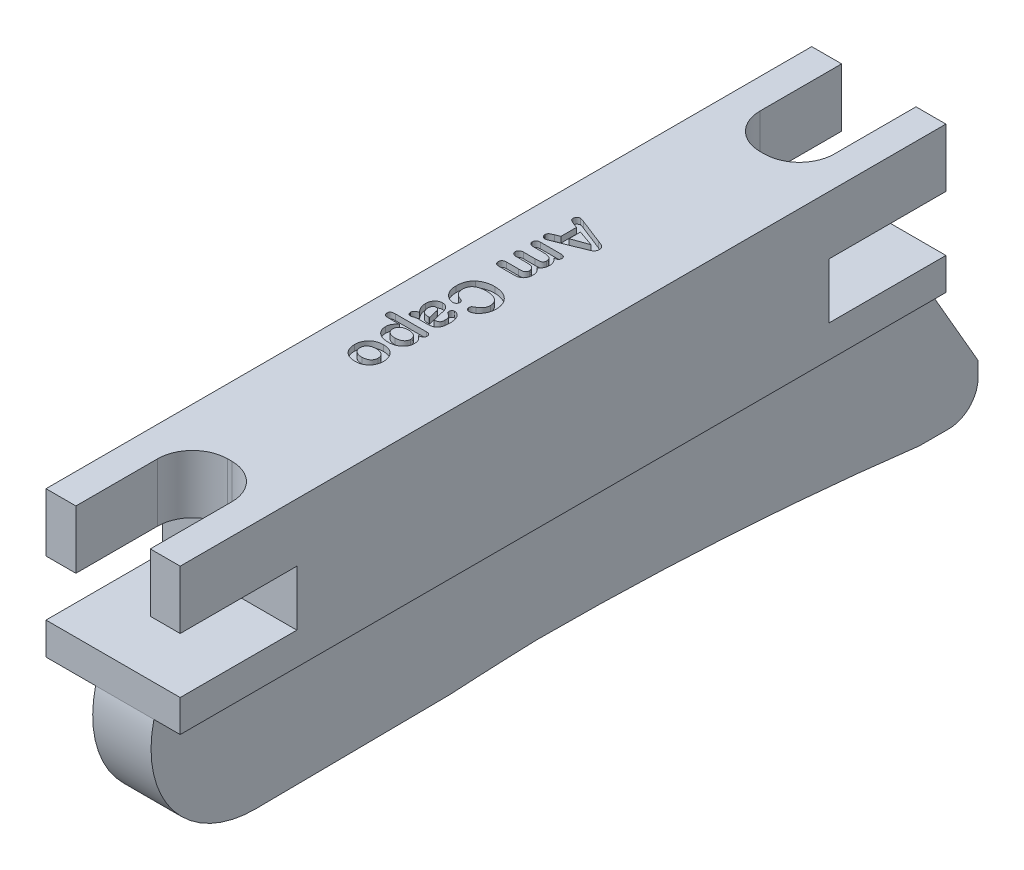
from build123d import *
from OCP.BRepFilletAPI import BRepFilletAPI_MakeChamfer

# Parameters (mm, degrees)
SKETCH2_W            = 11.684
SKETCH2_H            = 66.675
BOSS_EXTRUDE1_DEPTH  = 12.7
SKETCH3_W            = 5.08
SKETCH3_H            = 66.675
SKETCH3_H_2          = 5.08
BOSS_EXTRUDE2_DEPTH  = 12.7
CUT_EXTRUDE1_DEPTH   = 10.16
FILLET2_R            = 3.048
FILLET2_OF_MIRROR1_R = 3.048
CUT_EXTRUDE4_DEPTH   = 74.241572764
CUT_EXTRUDE5_DEPTH   = 0.508
CHAMFER1_SIZE        = 5.08
CHAMFER1_SIZE_2      = 8.798818102
BOSS_EXTRUDE3_DEPTH  = 5.08
FILLET3_R            = 2.54
CUT_EXTRUDE7_DEPTH   = 74.424564272


with BuildPart() as part:
    # Sketch2 → Boss-Extrude1 (new body)
    with BuildSketch(Plane(origin=(0, 0, 0), x_dir=(1, 0, 0), z_dir=(0, 1, 0))):
        with Locations((5.842, 33.3375)):
            Rectangle(SKETCH2_W, SKETCH2_H)
    extrude(amount=BOSS_EXTRUDE1_DEPTH)

    # Sketch3 → Boss-Extrude2 (add)
    with BuildSketch(Plane.XZ):
        with Locations((6.858, -33.3375)):
            Rectangle(SKETCH3_W, SKETCH3_H)
        with Locations((6.858, -69.215)):
            Rectangle(SKETCH3_W, SKETCH3_H_2)
        with Locations((6.858, 2.54)):
            Rectangle(SKETCH3_W, SKETCH3_H_2)
    extrude(amount=BOSS_EXTRUDE2_DEPTH)

    # Sketch4 → Cut-Extrude1 (cut)
    with BuildSketch(Plane.XY):
        Polygon((0, 7.62), (2.6035, 7.62), (2.6035, 12.7), (9.0805, 12.7), (9.0805, 7.62), (11.684, 7.62), (11.684, 2.794), (0, 2.794), align=None)
    cut_extrude1 = extrude(amount=-CUT_EXTRUDE1_DEPTH, mode=Mode.SUBTRACT)

    # Fillet2
    fillet2_edges = [part.edges().sort_by_distance(p)[0] for p in [
        (2.6035, 10.16, -10.16),
        (9.0805, 10.16, -10.16),
    ]]
    fillet(fillet2_edges, radius=FILLET2_R)

    # Mirror1: Cut-Extrude1 across plane
    add(cut_extrude1.mirror(Plane.XY.offset(-33.3375)), mode=Mode.SUBTRACT)

    # Fillet2 of Mirror1
    fillet2_of_mirror1_edges = [part.edges().sort_by_distance(p)[0] for p in [
        (2.6035, 10.16, -56.515),
        (9.0805, 10.16, -56.515),
    ]]
    fillet(fillet2_of_mirror1_edges, radius=FILLET2_OF_MIRROR1_R)

    # Sketch5 → Cut-Extrude4 (cut, through all)
    with BuildSketch(Plane.ZY.offset(-4.318)):
        with BuildLine():
            Line((-66.675, -12.7), (0, -12.7))
            ThreePointArc((0, -12.7), (-33.3375, -10.668), (-66.675, -12.7))
        make_face()
    extrude(amount=-CUT_EXTRUDE4_DEPTH, mode=Mode.SUBTRACT)

    # Sketch6 → Cut-Extrude5 (cut)
    # profile 1 of 6: a face of its own
    with BuildSketch(Plane(origin=(0, 12.7, 0), x_dir=(1, 0, 0), z_dir=(0, 1, 0))):
        with BuildLine():
            add(Edge.make_bspline(
                [(3.827132812, 23.05625), (3.781504243, 23.057239782), (3.691766633, 23.059186384), (3.560106764, 23.076349618), (3.433568163, 23.102382409), (3.3132634, 23.140919959), (3.199714977, 23.189371492), (3.093590228, 23.247263483), (2.996995776, 23.316645808), (2.907405092, 23.393504798), (2.82810537, 23.480916035), (2.758215777, 23.576341742), (2.697481033, 23.67942341), (2.647796863, 23.79073917), (2.607664085, 23.90939206), (2.580295602, 24.035754597), (2.562500875, 24.168860779), (2.560679944, 24.259998959), (2.55975, 24.306542969)],
                knots=[0, 0, 0, 0, 1.091259345, 2.146177441, 3.171619965, 4.178561867, 5.162889412, 6.121888061, 7.064316506, 8.003395826, 8.941144824, 9.881109978, 10.829245542, 11.797988921, 12.792769476, 13.820528274, 14.886949991, 16, 16, 16, 16], degree=3))
            add(Edge.make_bspline(
                [(2.55975, 24.306542969), (2.560583935, 24.352872717), (2.562213198, 24.443387383), (2.58125599, 24.575214147), (2.608108843, 24.700438636), (2.649346344, 24.817787788), (2.699716679, 24.928359847), (2.760751975, 25.031222651), (2.831717594, 25.126164008), (2.911722278, 25.21316981), (3.00086545, 25.291331758), (3.098124272, 25.359666663), (3.202884072, 25.418432205), (3.31534315, 25.466047871), (3.434856104, 25.503648602), (3.560632201, 25.531063231), (3.692748016, 25.546787096), (3.782657855, 25.548915033), (3.8285, 25.55)],
                knots=[0, 0, 0, 0, 1.11120768, 2.170972137, 3.191401705, 4.180825011, 5.150009136, 6.104010418, 7.045892499, 7.99039143, 8.936124897, 9.886087878, 10.83864551, 11.813968496, 12.812107101, 13.842035622, 14.899723118, 16, 16, 16, 16], degree=3))
            add(Edge.make_bspline(
                [(3.8285, 25.55), (3.874809089, 25.549001174), (3.965676938, 25.547041275), (4.099015034, 25.530084201), (4.2263778, 25.503243946), (4.346963148, 25.464467565), (4.460952104, 25.417147745), (4.566270872, 25.358649191), (4.663834875, 25.291631968), (4.751139088, 25.213758948), (4.830515954, 25.128108344), (4.899858962, 25.033060995), (4.959371339, 24.929332246), (5.00928736, 24.817585394), (5.048992538, 24.698813579), (5.076764742, 24.573259256), (5.094424274, 24.441943655), (5.096297721, 24.352173443), (5.09725, 24.306542969)],
                knots=[0, 0, 0, 0, 1.109551132, 2.177164951, 3.216234439, 4.224948079, 5.208872635, 6.169558664, 7.107368683, 8.039883902, 8.967540442, 9.901525901, 10.853306172, 11.828735993, 12.830446654, 13.849355003, 14.906820559, 16, 16, 16, 16], degree=3))
            add(Edge.make_bspline(
                [(5.09725, 24.306542969), (5.096291639, 24.260231721), (5.094410549, 24.169331074), (5.076917192, 24.036339538), (5.048468826, 23.909869753), (5.007946665, 23.790662509), (4.957097339, 23.678841388), (4.897240194, 23.574291196), (4.826110051, 23.478821194), (4.746168688, 23.391972151), (4.657435921, 23.313994246), (4.559897541, 23.24649139), (4.454800415, 23.187778597), (4.341628831, 23.140271799), (4.221760095, 23.102426832), (4.09553282, 23.07632151), (3.963411811, 23.059133908), (3.873217516, 23.057225235), (3.827132812, 23.05625)],
                knots=[0, 0, 0, 0, 1.106525973, 2.171911401, 3.199869828, 4.200585073, 5.175594314, 6.132220136, 7.07450443, 8.015024027, 8.949086891, 9.891921975, 10.845223852, 11.821449384, 12.820577379, 13.845023435, 14.89891642, 16, 16, 16, 16], degree=3))
        make_face()
        with BuildLine():
            add(Edge.make_bspline(
                [(3.827132812, 23.66875), (3.857455733, 23.669253201), (3.916395722, 23.670231295), (4.002105478, 23.678409297), (4.082608202, 23.692450053), (4.158472577, 23.709951911), (4.228550989, 23.735360399), (4.294162007, 23.764114424), (4.353638932, 23.800360953), (4.408661427, 23.840239417), (4.457004895, 23.885690101), (4.500062077, 23.934215647), (4.53573269, 23.987506418), (4.565163245, 24.044119631), (4.587917424, 24.1045044), (4.604436851, 24.168398622), (4.613934509, 24.236304224), (4.615302266, 24.282815948), (4.616, 24.306542969)],
                knots=[0, 0, 0, 0, 1.270595497, 2.469712118, 3.603154456, 4.694003366, 5.726889095, 6.722647569, 7.690497426, 8.639701942, 9.565367191, 10.465461596, 11.352699765, 12.245317202, 13.133839103, 14.050993671, 15.00575362, 16, 16, 16, 16], degree=3))
            add(Edge.make_bspline(
                [(4.616, 24.306542969), (4.615131391, 24.337177096), (4.613430307, 24.397171041), (4.594752496, 24.483834068), (4.566252312, 24.565248485), (4.524731238, 24.640022596), (4.472508621, 24.708012444), (4.409528164, 24.768898173), (4.333747364, 24.818843179), (4.248829356, 24.862195369), (4.154340788, 24.895930767), (4.051950579, 24.920575867), (3.941927636, 24.9349118), (3.866140093, 24.93662053), (3.827132812, 24.9375)],
                knots=[0, 0, 0, 0, 0.96705303, 1.893878874, 2.789407141, 3.685746366, 4.584860462, 5.491819201, 6.440915387, 7.442891259, 8.500283372, 9.604563114, 10.767086573, 12, 12, 12, 12], degree=3))
            add(Edge.make_bspline(
                [(3.827132812, 24.9375), (3.788574367, 24.936647134), (3.713681338, 24.93499059), (3.604936267, 24.920278808), (3.503513993, 24.896838601), (3.410166339, 24.86326704), (3.325751364, 24.821351044), (3.251618858, 24.770008106), (3.187215249, 24.711152453), (3.134205654, 24.643325927), (3.092044533, 24.568532628), (3.062742528, 24.486681688), (3.044372748, 24.398729762), (3.042145557, 24.3378543), (3.041, 24.306542969)],
                knots=[0, 0, 0, 0, 1.221452891, 2.372458373, 3.470695752, 4.514597835, 5.509283355, 6.448751658, 7.363470559, 8.263476682, 9.165479573, 10.07241203, 11.008543944, 12, 12, 12, 12], degree=3))
            add(Edge.make_bspline(
                [(3.041, 24.306542969), (3.041697421, 24.282815734), (3.043064564, 24.236303589), (3.052566629, 24.168401006), (3.069070247, 24.104495953), (3.091881334, 24.044150176), (3.121159217, 23.987277574), (3.157714363, 23.934434966), (3.200624958, 23.885648305), (3.249054063, 23.84028096), (3.304128987, 23.800118222), (3.363958335, 23.764508706), (3.429258225, 23.735142396), (3.499031772, 23.710106424), (3.574375238, 23.692417921), (3.65421047, 23.678415582), (3.739007767, 23.670250467), (3.797265423, 23.669258539), (3.827132812, 23.66875)],
                knots=[0, 0, 0, 0, 0.996887209, 1.954183106, 2.873773739, 3.764655653, 4.659643981, 5.554632309, 6.457117465, 7.385241384, 8.336967093, 9.315618294, 10.305307001, 11.340936189, 12.425381747, 13.552398284, 14.745169664, 16, 16, 16, 16], degree=3))
        make_face(mode=Mode.SUBTRACT)
    # profile 2 of 6: a face of its own
    with BuildSketch(Plane(origin=(0, 12.7, 0), x_dir=(1, 0, 0), z_dir=(0, 1, 0))):
        with BuildLine():
            Line((4.737679687, 27.78125), (4.659066406, 27.78125))
            add(Edge.make_bspline(
                [(4.659066406, 27.78125), (4.695000552, 27.752550703), (4.764199162, 27.697284288), (4.854494173, 27.60605423), (4.931665741, 27.514805067), (4.992560726, 27.419706103), (5.040370623, 27.321287419), (5.073023457, 27.216687675), (5.093395186, 27.105968682), (5.095947979, 27.029842733), (5.09725, 26.991015625)],
                knots=[0, 0, 0, 0, 1.173336753, 2.259501931, 3.271928111, 4.219334659, 5.135402612, 6.057309498, 7.009154491, 8, 8, 8, 8], degree=3))
            add(Edge.make_bspline(
                [(5.09725, 26.991015625), (5.095318145, 26.944181481), (5.091496345, 26.851529205), (5.063697477, 26.715157154), (5.015669131, 26.585330067), (4.961700737, 26.482364636), (4.909357935, 26.404749843), (4.865517285, 26.349185442), (4.817305152, 26.297085555), (4.765145185, 26.247607123), (4.708705307, 26.201142122), (4.647263964, 26.158848161), (4.582094318, 26.118950685), (4.512764788, 26.082271152), (4.439601711, 26.049252595), (4.362882107, 26.021544126), (4.283068166, 25.997362938), (4.199995558, 25.97760873), (4.113428723, 25.96269813), (4.023765662, 25.95188675), (3.930700731, 25.944691302), (3.867478584, 25.944067265), (3.835335937, 25.94375)],
                knots=[0, 0, 0, 0, 1.528238337, 3.023323336, 4.519758183, 6.033521898, 6.805016636, 7.572809931, 8.341287358, 9.11991911, 9.91795254, 10.724672492, 11.552509732, 12.410888457, 13.283107479, 14.170167426, 15.071333123, 16.003990564, 16.955292722, 17.936845165, 18.951075513, 20, 20, 20, 20], degree=3))
            add(Edge.make_bspline(
                [(3.835335937, 25.94375), (3.788112454, 25.94447395), (3.695440928, 25.945894633), (3.559624706, 25.962843358), (3.429231467, 25.986418247), (3.305817271, 26.022140345), (3.19047045, 26.066820714), (3.083112927, 26.117329286), (2.986443832, 26.177428783), (2.898785018, 26.243805981), (2.821318213, 26.31773047), (2.754045829, 26.398762231), (2.694652191, 26.484723624), (2.646072681, 26.577553472), (2.607892071, 26.675527458), (2.579681129, 26.777364626), (2.562805775, 26.883128875), (2.560777911, 26.954724338), (2.55975, 26.991015625)],
                knots=[0, 0, 0, 0, 1.225552878, 2.405029155, 3.549292819, 4.663622026, 5.735037092, 6.759253393, 7.739611413, 8.685210345, 9.610125572, 10.513205615, 11.415878476, 12.318434966, 13.227157865, 14.141584524, 15.057980963, 16, 16, 16, 16], degree=3))
            add(Edge.make_bspline(
                [(2.55975, 26.991015625), (2.561027194, 27.033478967), (2.563493631, 27.115481505), (2.583342198, 27.233234623), (2.616633163, 27.340722644), (2.665151917, 27.4383474), (2.72702349, 27.528838244), (2.799740551, 27.616536661), (2.885043388, 27.701729304), (2.948709382, 27.754201905), (2.981527344, 27.78125)],
                knots=[0, 0, 0, 0, 1.092260036, 2.10930392, 3.062543473, 3.97778116, 4.903181409, 5.877718058, 6.906025603, 8, 8, 8, 8], degree=3))
            Line((2.981527344, 27.78125), (2.019710937, 27.78125))
            add(Edge.make_bspline(
                [(2.019710937, 27.78125), (1.986609986, 27.782035512), (1.924607502, 27.783506882), (1.837765834, 27.797647968), (1.763775225, 27.821407687), (1.70291334, 27.856343019), (1.654649485, 27.900706436), (1.621091553, 27.956200257), (1.600675253, 28.021171431), (1.598432098, 28.067742926), (1.59725, 28.092285156)],
                knots=[0, 0, 0, 0, 1.33001148, 2.49128837, 3.525600985, 4.437006695, 5.29254635, 6.131641311, 7.015413011, 8, 8, 8, 8], degree=3))
            add(Edge.make_bspline(
                [(1.59725, 28.092285156), (1.597342558, 28.106894633), (1.59751975, 28.134862779), (1.603538525, 28.174814708), (1.611247655, 28.211157762), (1.622837525, 28.243662702), (1.638124627, 28.272168954), (1.656525111, 28.297114753), (1.678928438, 28.317938923), (1.713982952, 28.341366906), (1.767233148, 28.362843466), (1.840227759, 28.380655829), (1.925225938, 28.39256944), (1.985942433, 28.393339212), (2.01834375, 28.39375)],
                knots=[0, 0, 0, 0, 0.874698912, 1.674509344, 2.416841684, 3.099593518, 3.73521067, 4.349933258, 4.949129653, 5.55912881, 6.868543326, 8.362792448, 10.059006585, 12, 12, 12, 12], degree=3))
            Line((2.01834375, 28.39375), (4.743148437, 28.39375))
            add(Edge.make_bspline(
                [(4.743148437, 28.39375), (4.771482621, 28.393019629), (4.824738234, 28.391646858), (4.899007802, 28.376717737), (4.962295047, 28.351796692), (5.013262862, 28.31530574), (5.053546536, 28.270602222), (5.081580837, 28.217468379), (5.099511549, 28.157224394), (5.101170959, 28.114523288), (5.102035156, 28.092285156)],
                knots=[0, 0, 0, 0, 1.274934873, 2.396308233, 3.395220789, 4.315276865, 5.195051252, 6.081507868, 7.00087648, 8, 8, 8, 8], degree=3))
            add(Edge.make_bspline(
                [(5.102035156, 28.092285156), (5.10083011, 28.070300705), (5.098505765, 28.027896126), (5.081077302, 27.966882547), (5.050250966, 27.913102118), (5.008591614, 27.865905328), (4.956187867, 27.826817849), (4.891796092, 27.800472358), (4.818041221, 27.783918124), (4.765349583, 27.782168682), (4.737679687, 27.78125)],
                knots=[0, 0, 0, 0, 0.97573183, 1.882034617, 2.788280906, 3.705980645, 4.661295753, 5.663177366, 6.77286718, 8, 8, 8, 8], degree=3))
        make_face()
        with BuildLine():
            add(Edge.make_bspline(
                [(3.831917969, 26.55625), (3.87138869, 26.557081876), (3.947647106, 26.558689081), (4.057486624, 26.573422082), (4.158896973, 26.596261872), (4.251516599, 26.628852236), (4.3343456, 26.670731622), (4.407866631, 26.719287105), (4.470871922, 26.775867614), (4.52302975, 26.839644138), (4.563935209, 26.909011938), (4.594964716, 26.981830695), (4.612155337, 27.059042045), (4.614708947, 27.111477817), (4.616, 27.137988281)],
                knots=[0, 0, 0, 0, 1.30121544, 2.513980591, 3.647898742, 4.724690636, 5.74306597, 6.701881505, 7.622470714, 8.525092457, 9.407975465, 10.270504535, 11.125602123, 12, 12, 12, 12], degree=3))
            add(Edge.make_bspline(
                [(4.616, 27.137988281), (4.615244868, 27.15920749), (4.613760466, 27.200919142), (4.60496622, 27.262215851), (4.5892902, 27.320827424), (4.566067913, 27.376347915), (4.538350475, 27.43023351), (4.503036667, 27.480877559), (4.46154614, 27.528911723), (4.414666092, 27.57478225), (4.36125478, 27.61661215), (4.301628251, 27.652918201), (4.235600715, 27.682994204), (4.164108028, 27.708410115), (4.086308657, 27.726947811), (4.003072207, 27.741771199), (3.913645025, 27.749621316), (3.851983278, 27.750645548), (3.820296875, 27.751171875)],
                knots=[0, 0, 0, 0, 0.902184776, 1.773469393, 2.626468711, 3.473728321, 4.327332466, 5.197916759, 6.091006804, 7.022665092, 7.981866007, 8.968696632, 9.982866901, 11.061295835, 12.189021605, 13.378660771, 14.65296049, 16, 16, 16, 16], degree=3))
            add(Edge.make_bspline(
                [(3.820296875, 27.751171875), (3.790428185, 27.750669459), (3.732167992, 27.749689473), (3.647388672, 27.741439736), (3.567653448, 27.727762885), (3.492822477, 27.709122647), (3.423616716, 27.683222482), (3.358692172, 27.653726147), (3.299865752, 27.616846593), (3.245809919, 27.576200454), (3.197778314, 27.530916569), (3.156264281, 27.482284807), (3.120067915, 27.431632172), (3.091345992, 27.377726899), (3.06852719, 27.321667251), (3.052819706, 27.26263252), (3.043066997, 27.201203612), (3.041694096, 27.159215954), (3.041, 27.137988281)],
                knots=[0, 0, 0, 0, 1.288880695, 2.514018438, 3.671617053, 4.778346991, 5.836152296, 6.856826722, 7.850275696, 8.825846236, 9.771976063, 10.692511868, 11.581949935, 12.453151322, 13.322407875, 14.188376105, 15.084098501, 16, 16, 16, 16], degree=3))
            add(Edge.make_bspline(
                [(3.041, 27.137988281), (3.041978427, 27.112370201), (3.043922823, 27.061460203), (3.061809283, 26.986981821), (3.090478479, 26.915611074), (3.129051641, 26.846995279), (3.180383482, 26.783843566), (3.24248696, 26.726679997), (3.315991669, 26.676495054), (3.400303515, 26.63365715), (3.494789949, 26.598913681), (3.598862057, 26.573717448), (3.712298644, 26.558589067), (3.791081599, 26.557048525), (3.831917969, 26.55625)],
                knots=[0, 0, 0, 0, 0.839678771, 1.668666964, 2.497688886, 3.358447987, 4.241368201, 5.15690626, 6.11937314, 7.152810166, 8.253003143, 9.415598002, 10.660400639, 12, 12, 12, 12], degree=3))
        make_face(mode=Mode.SUBTRACT)
    # profile 3 of 6: a face of its own
    with BuildSketch(Plane(origin=(0, 12.7, 0), x_dir=(1, 0, 0), z_dir=(0, 1, 0))):
        with BuildLine():
            add(Edge.make_bspline(
                [(2.936410156, 29.577050781), (2.906610435, 29.614104585), (2.848917661, 29.68584139), (2.771597832, 29.79539679), (2.707542746, 29.903913613), (2.652339906, 30.010803813), (2.610731069, 30.121307147), (2.581478374, 30.236850276), (2.563206118, 30.358730897), (2.560919355, 30.442187195), (2.55975, 30.484863281)],
                knots=[0, 0, 0, 0, 1.134918657, 2.197222132, 3.197207938, 4.141015931, 5.065376899, 6.008620489, 6.981691201, 8, 8, 8, 8], degree=3))
            add(Edge.make_bspline(
                [(2.55975, 30.484863281), (2.560996407, 30.523657374), (2.563421244, 30.599129759), (2.580357854, 30.708772972), (2.610086404, 30.810543237), (2.650212585, 30.905017333), (2.701735244, 30.98987103), (2.76039669, 31.066407369), (2.828976897, 31.130939498), (2.904409527, 31.185091441), (2.985585563, 31.228636129), (3.071796963, 31.258242372), (3.160886634, 31.27789136), (3.221591912, 31.280123445), (3.252230469, 31.28125)],
                knots=[0, 0, 0, 0, 1.18420515, 2.303824621, 3.375910304, 4.413522982, 5.427550473, 6.398827283, 7.348465677, 8.290532625, 9.227164998, 10.148982359, 11.065773, 12, 12, 12, 12], degree=3))
            add(Edge.make_bspline(
                [(3.252230469, 31.28125), (3.27274699, 31.280589386), (3.313207044, 31.279286608), (3.373129358, 31.273006949), (3.430271275, 31.259337044), (3.485586157, 31.242887309), (3.537626164, 31.219333632), (3.588836343, 31.193453143), (3.63619272, 31.160007643), (3.681792052, 31.123147634), (3.723830419, 31.081434991), (3.762890254, 31.036175238), (3.798816138, 30.987557689), (3.830205838, 30.9344648), (3.858095687, 30.877703665), (3.882837838, 30.817509486), (3.903446471, 30.753462037), (3.914016751, 30.709160635), (3.919417969, 30.686523438)],
                knots=[0, 0, 0, 0, 1.01250585, 1.996734246, 2.964656916, 3.906654277, 4.83786248, 5.777980677, 6.731903795, 7.690318475, 8.667850486, 9.647963445, 10.637056683, 11.645124027, 12.68556377, 13.754152863, 14.852413628, 16, 16, 16, 16], degree=3))
            add(Edge.make_bspline(
                [(3.919417969, 30.686523438), (3.92077232, 30.680596027), (3.923899517, 30.666909631), (3.929555334, 30.643761164), (3.935441145, 30.614939793), (3.943034914, 30.580776396), (3.952087447, 30.541214), (3.961466996, 30.49577804), (3.972506932, 30.445034257), (3.987556192, 30.371064276), (4.007436317, 30.279191326), (4.03151831, 30.173773082), (4.05411983, 30.076713566), (4.082472096, 29.955674956), (4.124106753, 29.803956395), (4.159846292, 29.682264981), (4.1785, 29.61875)],
                knots=[0, 0, 0, 0, 0.232329944, 0.53645003, 0.910442946, 1.356200488, 1.873732251, 2.461176041, 3.128890498, 3.858040884, 5.345500004, 6.720561501, 7.989893742, 9.153532225, 11.470459955, 14, 14, 14, 14], degree=3))
            add(Edge.make_bspline(
                [(4.1785, 29.61875), (4.217347759, 29.621218301), (4.290124117, 29.625842351), (4.390496629, 29.646338337), (4.474905317, 29.67503337), (4.533887867, 29.708358064), (4.572329546, 29.741959461), (4.595466388, 29.773870558), (4.616064383, 29.810660984), (4.632325189, 29.853536657), (4.644516056, 29.902198306), (4.65305558, 29.956656398), (4.658555225, 30.016947002), (4.65934083, 30.058971558), (4.65975, 30.080859375)],
                knots=[0, 0, 0, 0, 1.801419441, 3.374731284, 4.730208451, 5.917792687, 6.485835615, 7.081173764, 7.733231515, 8.434998629, 9.197926469, 10.053449113, 10.986170169, 12, 12, 12, 12], degree=3))
            add(Edge.make_bspline(
                [(4.65975, 30.080859375), (4.65906538, 30.118038181), (4.65778414, 30.187616855), (4.645898996, 30.284901038), (4.62548901, 30.367723904), (4.59535018, 30.437410328), (4.5559461, 30.496441537), (4.509722754, 30.550047992), (4.455479595, 30.599963398), (4.393821792, 30.641545038), (4.334997992, 30.679255746), (4.285309811, 30.712555196), (4.246736487, 30.739555298), (4.216589883, 30.76079206), (4.19465541, 30.786580021), (4.183214868, 30.821373074), (4.174667163, 30.864736608), (4.174053921, 30.897002889), (4.173714844, 30.91484375)],
                knots=[0, 0, 0, 0, 1.73013111, 3.237872341, 4.552513207, 5.687673037, 6.752672015, 7.843349881, 8.977121257, 10.171964914, 11.298768358, 12.231350577, 12.955203784, 13.491991011, 13.94425741, 14.501711647, 15.171557632, 16, 16, 16, 16], degree=3))
            add(Edge.make_bspline(
                [(4.173714844, 30.91484375), (4.174408325, 30.931796218), (4.175770304, 30.96509042), (4.189337993, 31.012865818), (4.210961292, 31.056827327), (4.240306111, 31.09623417), (4.276098858, 31.130158354), (4.318620646, 31.154211836), (4.365705178, 31.169408984), (4.398726284, 31.171037535), (4.415707031, 31.171875)],
                knots=[0, 0, 0, 0, 1.032443871, 2.027692603, 3.004109543, 4.008160394, 5.011922295, 5.989922401, 6.966339342, 8, 8, 8, 8], degree=3))
            add(Edge.make_bspline(
                [(4.415707031, 31.171875), (4.443193342, 31.170355495), (4.498787372, 31.167282131), (4.581007452, 31.144092122), (4.661980003, 31.107370421), (4.740715465, 31.055443426), (4.816608738, 30.989017467), (4.884934316, 30.905091043), (4.945976584, 30.805132643), (4.999654289, 30.689468907), (5.044260174, 30.558157523), (5.074889204, 30.411050512), (5.094311505, 30.24931731), (5.096243867, 30.136291241), (5.09725, 30.077441406)],
                knots=[0, 0, 0, 0, 0.693420704, 1.402518181, 2.141636884, 2.931686233, 3.775620559, 4.678911608, 5.653034846, 6.726531372, 7.892968482, 9.146908502, 10.514466916, 12, 12, 12, 12], degree=3))
            add(Edge.make_bspline(
                [(5.09725, 30.077441406), (5.097069135, 30.044166082), (5.096717112, 29.979401255), (5.091633548, 29.884795479), (5.084316939, 29.79563486), (5.07426089, 29.711871669), (5.060745784, 29.633784955), (5.043448602, 29.561083054), (5.023991877, 29.493631341), (5.00134729, 29.431413823), (4.975405863, 29.374425356), (4.945669912, 29.321819507), (4.912610863, 29.273673586), (4.875648491, 29.229821128), (4.835573037, 29.190210037), (4.791319938, 29.15495165), (4.743430512, 29.124520818), (4.692405647, 29.097310524), (4.637163178, 29.075092849), (4.578067428, 29.05519515), (4.514936495, 29.037940721), (4.447125429, 29.025574434), (4.375419099, 29.014115211), (4.299141978, 29.007202839), (4.21867721, 29.001966536), (4.163698596, 29.001635191), (4.135433594, 29.001464844)],
                knots=[0, 0, 0, 0, 1.416304911, 2.756599448, 4.031746177, 5.224033762, 6.346700176, 7.403089038, 8.403721962, 9.333538543, 10.218988155, 11.065987521, 11.902761167, 12.701332918, 13.503841873, 14.297627645, 15.104812584, 15.916182868, 16.75559468, 17.635929123, 18.570036295, 19.538318192, 20.568554759, 21.660160367, 22.797067306, 24, 24, 24, 24], degree=3))
            add(Edge.make_bspline(
                [(4.135433594, 29.001464844), (4.100342562, 29.001493383), (4.032894866, 29.001548239), (3.935822168, 29.001171955), (3.846959124, 29.002424099), (3.736663937, 29.001746483), (3.596309126, 29.004591929), (3.482830226, 29.005678404), (3.423128906, 29.00625)],
                knots=[0, 0, 0, 0, 0.886722124, 1.704349017, 2.452902826, 3.132339258, 4.49132191, 6, 6, 6, 6], degree=3))
            add(Edge.make_bspline(
                [(3.423128906, 29.00625), (3.393472758, 29.005630026), (3.333506219, 29.004376401), (3.242786906, 28.992762293), (3.150222553, 28.974409767), (3.059570787, 28.948636827), (2.977027412, 28.922303109), (2.906969508, 28.905224292), (2.85463615, 28.891700508), (2.824571553, 28.889530291), (2.812679687, 28.888671875)],
                knots=[0, 0, 0, 0, 1.140195027, 2.30554383, 3.512149168, 4.766631608, 5.928448693, 6.842497462, 7.542157007, 8, 8, 8, 8], degree=3))
            add(Edge.make_bspline(
                [(2.812679687, 28.888671875), (2.79703654, 28.889707423), (2.765268806, 28.891810391), (2.719215714, 28.910033936), (2.676319442, 28.939893488), (2.636818956, 28.979003881), (2.603242697, 29.025187721), (2.578259179, 29.075765033), (2.562174239, 29.129464193), (2.560565402, 29.166553641), (2.55975, 29.185351562)],
                knots=[0, 0, 0, 0, 0.875490473, 1.777925396, 2.735475759, 3.793375106, 4.882946873, 5.923706805, 6.947679186, 8, 8, 8, 8], degree=3))
            add(Edge.make_bspline(
                [(2.55975, 29.185351562), (2.5610186, 29.201688137), (2.56361083, 29.23506993), (2.583005713, 29.284222997), (2.613714169, 29.332524807), (2.657428044, 29.379666497), (2.711931575, 29.427349719), (2.77735243, 29.476111615), (2.852339461, 29.527809293), (2.907467989, 29.560098913), (2.936410156, 29.577050781)],
                knots=[0, 0, 0, 0, 0.69255206, 1.41514551, 2.215225972, 3.112878123, 4.134275469, 5.28776696, 6.576092927, 8, 8, 8, 8], degree=3))
        make_face()
        with BuildLine():
            add(Edge.make_bspline(
                [(3.78475, 29.61875), (3.77647886, 29.644185812), (3.758309008, 29.700062622), (3.735733452, 29.792905376), (3.709819417, 29.90072063), (3.685424341, 30.018477169), (3.663536346, 30.134366232), (3.641820786, 30.235338825), (3.625092258, 30.316412871), (3.610442314, 30.380451027), (3.594960157, 30.434438027), (3.57360037, 30.483429532), (3.546387577, 30.53119724), (3.514582444, 30.576978274), (3.476470925, 30.618568806), (3.428267253, 30.647469839), (3.373689107, 30.666370683), (3.334656632, 30.667938077), (3.3144375, 30.66875)],
                knots=[0, 0, 0, 0, 1.043977844, 2.293386608, 3.728469663, 5.37392038, 6.987897688, 8.333217955, 9.406358624, 10.219929069, 10.898257848, 11.595688491, 12.30085073, 13.041383056, 13.771256586, 14.482343253, 15.213841736, 16, 16, 16, 16], degree=3))
            add(Edge.make_bspline(
                [(3.3144375, 30.66875), (3.29310231, 30.667413459), (3.251065618, 30.664780075), (3.190412259, 30.64433492), (3.136268839, 30.60839868), (3.087200902, 30.5616565), (3.046779963, 30.503346995), (3.018032866, 30.43540134), (2.999715537, 30.359585439), (2.998090876, 30.306100287), (2.99725, 30.278417969)],
                knots=[0, 0, 0, 0, 0.912396036, 1.79769247, 2.701443981, 3.674205933, 4.683500188, 5.714572396, 6.817130875, 8, 8, 8, 8], degree=3))
            add(Edge.make_bspline(
                [(2.99725, 30.278417969), (2.998113213, 30.247820357), (2.999810872, 30.187644764), (3.014927794, 30.099467286), (3.037912728, 30.014713093), (3.070528676, 29.934985922), (3.1102139, 29.861878101), (3.157078221, 29.798827563), (3.208264057, 29.744560296), (3.247844128, 29.717028088), (3.267269531, 29.703515625)],
                knots=[0, 0, 0, 0, 1.110580976, 2.184153044, 3.240356413, 4.294709725, 5.306018023, 6.252887922, 7.142539285, 8, 8, 8, 8], degree=3))
            add(Edge.make_bspline(
                [(3.267269531, 29.703515625), (3.278965833, 29.696601455), (3.303431043, 29.682139053), (3.345089829, 29.66570045), (3.391458617, 29.650205838), (3.443640566, 29.639425586), (3.500526094, 29.629248906), (3.562965271, 29.623872305), (3.630647889, 29.619372192), (3.677644008, 29.618962587), (3.702035156, 29.61875)],
                knots=[0, 0, 0, 0, 0.726422996, 1.519462499, 2.391443271, 3.341603541, 4.368558488, 5.484230519, 6.694306944, 8, 8, 8, 8], degree=3))
            Line((3.702035156, 29.61875), (3.78475, 29.61875))
        make_face(mode=Mode.SUBTRACT)
    # profile 4 of 6: a face of its own
    with BuildSketch(Plane(origin=(0, 12.7, 0), x_dir=(1, 0, 0), z_dir=(0, 1, 0))):
        with BuildLine():
            add(Edge.make_bspline(
                [(3.676058594, 31.760449219), (3.648877247, 31.761377515), (3.592755254, 31.763294192), (3.507387446, 31.779421236), (3.41855511, 31.80409855), (3.327353415, 31.839272017), (3.234009944, 31.883657747), (3.14269289, 31.942497588), (3.050385982, 32.009872886), (2.960716259, 32.08974929), (2.874900015, 32.180683546), (2.798402833, 32.285215881), (2.729063639, 32.400305917), (2.668879175, 32.527184348), (2.619096461, 32.665374314), (2.584936057, 32.815713748), (2.563197479, 32.976607761), (2.560919674, 33.087686592), (2.55975, 33.144726562)],
                knots=[0, 0, 0, 0, 0.663761881, 1.370485424, 2.116230119, 2.914583441, 3.756322298, 4.636944192, 5.564631322, 6.546800301, 7.567180637, 8.614018113, 9.705514259, 10.846235634, 12.040326922, 13.286970952, 14.606835385, 16, 16, 16, 16], degree=3))
            add(Edge.make_bspline(
                [(2.55975, 33.144726562), (2.560113838, 33.188271011), (2.560825318, 33.273421532), (2.571102297, 33.398171725), (2.585541811, 33.516929072), (2.606826918, 33.629999698), (2.63461721, 33.737463054), (2.669865639, 33.83962307), (2.710586559, 33.93735384), (2.759574251, 34.030053068), (2.815897778, 34.118864061), (2.880389277, 34.203457301), (2.952356687, 34.28511132), (3.006136423, 34.334861177), (3.033480469, 34.36015625)],
                knots=[0, 0, 0, 0, 1.162468236, 2.273189298, 3.340388953, 4.355981916, 5.343347398, 6.301634985, 7.239655383, 8.167795133, 9.097907467, 10.044728383, 11.005851632, 12, 12, 12, 12], degree=3))
            add(Edge.make_bspline(
                [(3.033480469, 34.36015625), (3.060800899, 34.382130276), (3.115560981, 34.426174219), (3.202757616, 34.486688108), (3.295214408, 34.540973319), (3.391890639, 34.591119013), (3.49265623, 34.636190949), (3.597297687, 34.674997177), (3.705194661, 34.708162886), (3.816731026, 34.734441991), (3.931439212, 34.755811409), (4.049661411, 34.770763639), (4.171062689, 34.779853028), (4.253223668, 34.780781279), (4.294710937, 34.78125)],
                knots=[0, 0, 0, 0, 0.929579628, 1.863215794, 2.811442728, 3.770866755, 4.750067034, 5.736659851, 6.728696515, 7.741441351, 8.773736808, 9.82153209, 10.89998041, 12, 12, 12, 12], degree=3))
            add(Edge.make_bspline(
                [(4.294710937, 34.78125), (4.361546915, 34.779906032), (4.491971143, 34.777283403), (4.681950073, 34.75397171), (4.861612631, 34.71782567), (5.029975122, 34.664934712), (5.18734757, 34.598311343), (5.333533298, 34.519428996), (5.467232377, 34.426045314), (5.588939842, 34.320927919), (5.697827734, 34.204372924), (5.793569608, 34.078155347), (5.874336795, 33.941906818), (5.941376027, 33.797592666), (5.993771924, 33.646321431), (6.032514489, 33.489706453), (6.055439605, 33.327927468), (6.058305342, 33.218398612), (6.05975, 33.163183594)],
                knots=[0, 0, 0, 0, 1.192112992, 2.326298229, 3.409941313, 4.457974682, 5.469120545, 6.455229552, 7.416174064, 8.373145202, 9.319529369, 10.257104057, 11.194246681, 12.140141643, 13.091655962, 14.046205698, 15.015065133, 16, 16, 16, 16], degree=3))
            add(Edge.make_bspline(
                [(6.05975, 33.163183594), (6.059172133, 33.129447363), (6.058030585, 33.062803077), (6.050545596, 32.964178433), (6.037442628, 32.868367022), (6.019657979, 32.775265864), (5.997412402, 32.684933979), (5.969028334, 32.597565478), (5.935766677, 32.513049506), (5.897197669, 32.431888346), (5.855880263, 32.354194118), (5.811297203, 32.281142228), (5.764946685, 32.21237354), (5.71538065, 32.148657114), (5.663892568, 32.089213206), (5.609305995, 32.035131451), (5.553446617, 31.984727713), (5.494669201, 31.940217733), (5.435848353, 31.89979544), (5.376574387, 31.865708927), (5.318775444, 31.83609853), (5.26139736, 31.812005414), (5.205145494, 31.792495828), (5.149155342, 31.779806091), (5.094343618, 31.770908553), (5.057863625, 31.76985621), (5.039828125, 31.769335937)],
                knots=[0, 0, 0, 0, 1.284736816, 2.537935168, 3.763919844, 4.965430439, 6.14611068, 7.304156796, 8.461129548, 9.602375598, 10.724324469, 11.810709607, 12.860075595, 13.880667415, 14.883095403, 15.852568995, 16.805236766, 17.745933824, 18.658102246, 19.521326707, 20.347922674, 21.129570989, 21.889681073, 22.611635347, 23.313600478, 24, 24, 24, 24], degree=3))
            add(Edge.make_bspline(
                [(5.039828125, 31.769335937), (5.020822107, 31.770469751), (4.983343762, 31.772705539), (4.92873942, 31.788122498), (4.878178018, 31.8148856), (4.832337403, 31.850717064), (4.793234067, 31.893913443), (4.76501758, 31.943152295), (4.746519384, 31.996600323), (4.744740079, 32.033960838), (4.743832031, 32.053027344)],
                knots=[0, 0, 0, 0, 1.004600132, 1.980990953, 2.972502221, 4.011199951, 5.043730753, 6.031501978, 6.995399868, 8, 8, 8, 8], degree=3))
            add(Edge.make_bspline(
                [(4.743832031, 32.053027344), (4.744607446, 32.073586663), (4.746077542, 32.112564719), (4.75723856, 32.16718483), (4.777217251, 32.213602215), (4.806352164, 32.253025043), (4.846864985, 32.28672406), (4.895520435, 32.322991709), (4.956761647, 32.359581976), (5.001453898, 32.383838776), (5.025472656, 32.396875)],
                knots=[0, 0, 0, 0, 1.035936609, 1.964014232, 2.791964153, 3.563763981, 4.40975861, 5.436550943, 6.622336929, 8, 8, 8, 8], degree=3))
            add(Edge.make_bspline(
                [(5.025472656, 32.396875), (5.06586476, 32.419276377), (5.143789229, 32.462493127), (5.248356274, 32.538717075), (5.336720464, 32.620974715), (5.409706274, 32.709653014), (5.466219009, 32.807449693), (5.506955571, 32.915097156), (5.530033605, 33.033695169), (5.533143274, 33.115915987), (5.53475, 33.158398437)],
                knots=[0, 0, 0, 0, 1.14083101, 2.200891824, 3.189077095, 4.117958574, 5.028926365, 5.968284059, 6.950238216, 8, 8, 8, 8], degree=3))
            add(Edge.make_bspline(
                [(5.53475, 33.158398437), (5.533989449, 33.192645871), (5.53249532, 33.259926184), (5.516082011, 33.35775723), (5.490929724, 33.450517287), (5.455212225, 33.537816012), (5.409092873, 33.619824239), (5.352276428, 33.69619324), (5.285864362, 33.767626946), (5.208674484, 33.83253289), (5.122597933, 33.89121948), (5.02784489, 33.942646046), (4.924554349, 33.985863453), (4.812499379, 34.020435163), (4.691802563, 34.047624794), (4.562532369, 34.067307812), (4.424804705, 34.07886252), (4.330280095, 34.080439766), (4.281722656, 34.08125)],
                knots=[0, 0, 0, 0, 0.93687387, 1.840522352, 2.707838104, 3.564042072, 4.416076025, 5.27708558, 6.164367737, 7.08065677, 8.032431866, 9.012357809, 10.027405038, 11.092984147, 12.219056669, 13.412034725, 14.67055822, 16, 16, 16, 16], degree=3))
            add(Edge.make_bspline(
                [(4.281722656, 34.08125), (4.248907372, 34.080739548), (4.184838046, 34.079742931), (4.090595933, 34.075362282), (4.000827331, 34.066060241), (3.914915214, 34.055006765), (3.833534416, 34.039016569), (3.756315076, 34.020180207), (3.683369092, 33.997303712), (3.614412727, 33.971839714), (3.550096584, 33.941733644), (3.489006855, 33.910936717), (3.432658252, 33.87603446), (3.381527927, 33.837153524), (3.333094573, 33.797088044), (3.289434216, 33.753343774), (3.250292967, 33.706536738), (3.203703931, 33.640804877), (3.155652787, 33.551759815), (3.114360356, 33.436103048), (3.089122418, 33.31169991), (3.086232538, 33.225739291), (3.08475, 33.181640625)],
                knots=[0, 0, 0, 0, 1.161553928, 2.267844956, 3.337521837, 4.354876395, 5.332324156, 6.271183164, 7.166498703, 8.03676548, 8.870388927, 9.678339179, 10.457105351, 11.211953333, 11.95024944, 12.680173417, 13.395744503, 14.107305225, 15.529077856, 16.96015186, 18.440527169, 20, 20, 20, 20], degree=3))
            add(Edge.make_bspline(
                [(3.08475, 33.181640625), (3.085002186, 33.157462314), (3.085498352, 33.109892545), (3.093603194, 33.040290737), (3.104935416, 32.973273054), (3.121482518, 32.909373993), (3.141687902, 32.847790895), (3.168118885, 32.789814829), (3.198112482, 32.734058136), (3.23295042, 32.681297459), (3.272974026, 32.632030317), (3.316901151, 32.585499218), (3.364518847, 32.541313438), (3.417796959, 32.501966105), (3.474722479, 32.464724387), (3.536192517, 32.430737343), (3.601911394, 32.399747337), (3.647901092, 32.382432404), (3.671273437, 32.373632812)],
                knots=[0, 0, 0, 0, 1.080453892, 2.125745732, 3.129130718, 4.117609764, 5.07455133, 6.023212249, 6.962414916, 7.903439618, 8.845456672, 9.796903999, 10.763291339, 11.745501622, 12.754406698, 13.803416246, 14.883677954, 16, 16, 16, 16], degree=3))
            add(Edge.make_bspline(
                [(3.671273437, 32.373632812), (3.693048387, 32.366220105), (3.735113617, 32.351900106), (3.793749556, 32.325828984), (3.846456775, 32.297817538), (3.892870479, 32.266742787), (3.932849415, 32.22926271), (3.960532024, 32.180391008), (3.976060706, 32.121862805), (3.977909687, 32.08001433), (3.978890625, 32.0578125)],
                knots=[0, 0, 0, 0, 1.148496955, 2.218686643, 3.201603313, 4.126665737, 5.003998617, 5.91181356, 6.892156541, 8, 8, 8, 8], degree=3))
            add(Edge.make_bspline(
                [(3.978890625, 32.0578125), (3.977910036, 32.038083056), (3.975981201, 31.999274916), (3.958511513, 31.943664833), (3.931800829, 31.89177113), (3.893136274, 31.846864812), (3.847953479, 31.808172237), (3.795469632, 31.780385), (3.73749475, 31.763315288), (3.696914065, 31.761422151), (3.676058594, 31.760449219)],
                knots=[0, 0, 0, 0, 1.000050397, 1.967115494, 2.935635085, 3.946684534, 4.957733984, 5.941906876, 6.942292355, 8, 8, 8, 8], degree=3))
        make_face()
    # profile 5 of 6: a face of its own
    with BuildSketch(Plane(origin=(0, 12.7, 0), x_dir=(1, 0, 0), z_dir=(0, 1, 0))):
        with BuildLine():
            Line((3.786117187, 37.975), (2.954183594, 37.975))
            add(Edge.make_bspline(
                [(2.954183594, 37.975), (2.923338143, 37.975878008), (2.864981292, 37.977539122), (2.783373075, 37.994309551), (2.713866233, 38.023035235), (2.65708713, 38.063356319), (2.613267035, 38.11353237), (2.582049132, 38.171488509), (2.562862639, 38.236765491), (2.560813173, 38.282709318), (2.55975, 38.306542969)],
                knots=[0, 0, 0, 0, 1.266358617, 2.395837985, 3.40284976, 4.335732349, 5.231599188, 6.115692377, 7.022503512, 8, 8, 8, 8], degree=3))
            add(Edge.make_bspline(
                [(2.55975, 38.306542969), (2.560843764, 38.329686433), (2.562961405, 38.374494561), (2.58186295, 38.438120989), (2.613709039, 38.494363979), (2.657295371, 38.543564924), (2.713696335, 38.584063962), (2.78356354, 38.611716326), (2.86495026, 38.628783323), (2.923327413, 38.630397043), (2.954183594, 38.63125)],
                knots=[0, 0, 0, 0, 0.959247536, 1.857201947, 2.725516035, 3.623470446, 4.565917911, 5.579597411, 6.720657367, 8, 8, 8, 8], degree=3))
            Line((2.954183594, 38.63125), (3.951546875, 38.63125))
            add(Edge.make_bspline(
                [(3.951546875, 38.63125), (3.988692841, 38.631223581), (4.058674033, 38.631173808), (4.156897567, 38.634906505), (4.241936742, 38.639459486), (4.315156116, 38.645540119), (4.379305611, 38.656964235), (4.436493623, 38.675290013), (4.487720355, 38.700814077), (4.533240201, 38.733049666), (4.571351895, 38.774445714), (4.597651207, 38.82742662), (4.613232332, 38.890133271), (4.615039715, 38.935350526), (4.616, 38.959375)],
                knots=[0, 0, 0, 0, 1.575327959, 2.967841215, 4.168135644, 5.187490071, 6.082165716, 6.925686306, 7.72526632, 8.500469833, 9.28059761, 10.084546151, 10.982296201, 12, 12, 12, 12], degree=3))
            add(Edge.make_bspline(
                [(4.616, 38.959375), (4.615337257, 38.984015012), (4.614067681, 39.031216385), (4.604681588, 39.098719982), (4.588351273, 39.159691135), (4.565025404, 39.214352632), (4.535055951, 39.262570717), (4.497927836, 39.303850858), (4.454336163, 39.338254591), (4.404242947, 39.366313631), (4.34823843, 39.389290145), (4.286705548, 39.409003945), (4.219448176, 39.42513591), (4.146667297, 39.438774807), (4.068216997, 39.44976157), (3.983778995, 39.456891792), (3.893731589, 39.461976909), (3.83169796, 39.462322325), (3.799789062, 39.4625)],
                knots=[0, 0, 0, 0, 1.072726865, 2.054957592, 2.959985853, 3.813338004, 4.633692391, 5.420603725, 6.218633423, 7.040726042, 7.912341107, 8.850536995, 9.851629862, 10.921921998, 12.073946012, 13.299226168, 14.610774249, 16, 16, 16, 16], degree=3))
            Line((3.799789062, 39.4625), (2.954183594, 39.4625))
            add(Edge.make_bspline(
                [(2.954183594, 39.4625), (2.923552126, 39.463328724), (2.865843245, 39.464890019), (2.78516301, 39.482184428), (2.715847019, 39.509952119), (2.658609997, 39.549459611), (2.61388122, 39.598701923), (2.582958279, 39.656375095), (2.562694973, 39.720474309), (2.560751978, 39.765855379), (2.55975, 39.789257812)],
                knots=[0, 0, 0, 0, 1.266988192, 2.386972462, 3.398328206, 4.340886206, 5.243074081, 6.125898592, 7.033549998, 8, 8, 8, 8], degree=3))
            add(Edge.make_bspline(
                [(2.55975, 39.789257812), (2.560869895, 39.812393548), (2.56304872, 39.857405546), (2.581874651, 39.921833894), (2.614279366, 39.97877973), (2.657950618, 40.029235864), (2.714923361, 40.069991156), (2.784429987, 40.098325157), (2.865070777, 40.11656772), (2.922854711, 40.117993727), (2.9535, 40.11875)],
                knots=[0, 0, 0, 0, 0.955872848, 1.859709514, 2.746023205, 3.64789137, 4.600178314, 5.613935963, 6.734568273, 8, 8, 8, 8], degree=3))
            Line((2.9535, 40.11875), (4.742464844, 40.11875))
            add(Edge.make_bspline(
                [(4.742464844, 40.11875), (4.770101113, 40.117683688), (4.822409743, 40.115665422), (4.895992186, 40.101195351), (4.959150319, 40.075017781), (5.011201116, 40.038319021), (5.052405501, 39.99328902), (5.081733645, 39.940656438), (5.099397212, 39.881061927), (5.101134632, 39.839056842), (5.102035156, 39.817285156)],
                knots=[0, 0, 0, 0, 1.248966492, 2.363985007, 3.370183095, 4.316060979, 5.220194925, 6.105537004, 7.018079506, 8, 8, 8, 8], degree=3))
            add(Edge.make_bspline(
                [(5.102035156, 39.817285156), (5.101007203, 39.796221694), (5.099020526, 39.755513343), (5.082883377, 39.696874237), (5.054862515, 39.644350507), (5.017213555, 39.597781037), (4.970366036, 39.558504088), (4.913723336, 39.531317106), (4.849389416, 39.514402381), (4.803873684, 39.512640476), (4.7800625, 39.51171875)],
                knots=[0, 0, 0, 0, 1.012533589, 1.956875484, 2.898540199, 3.857472998, 4.823338609, 5.81384557, 6.856331155, 8, 8, 8, 8], degree=3))
            Line((4.7800625, 39.51171875), (4.720589844, 39.51171875))
            add(Edge.make_bspline(
                [(4.720589844, 39.51171875), (4.751495812, 39.48453811), (4.811384416, 39.431868327), (4.889097834, 39.344631303), (4.954658891, 39.25514066), (5.007248165, 39.161662835), (5.048098435, 39.064457494), (5.076838778, 38.962319166), (5.094421459, 38.854941824), (5.096295126, 38.781480813), (5.09725, 38.744042969)],
                knots=[0, 0, 0, 0, 1.114634638, 2.159903633, 3.159301083, 4.116094819, 5.060065846, 6.010198919, 6.985940124, 8, 8, 8, 8], degree=3))
            add(Edge.make_bspline(
                [(5.09725, 38.744042969), (5.096015287, 38.705701909), (5.093621087, 38.63135579), (5.076678178, 38.523746537), (5.047147187, 38.424479877), (5.006165042, 38.333337302), (4.952410827, 38.25061054), (4.887083819, 38.1758336), (4.809472005, 38.108456315), (4.750748079, 38.071318549), (4.720589844, 38.052246094)],
                knots=[0, 0, 0, 0, 1.110106727, 2.152578117, 3.144193379, 4.100926543, 5.036166651, 5.990211141, 6.967853688, 8, 8, 8, 8], degree=3))
            add(Edge.make_bspline(
                [(4.720589844, 38.052246094), (4.75085654, 38.02535606), (4.809694923, 37.9730819), (4.888823395, 37.889126771), (4.952768194, 37.800086851), (5.006734685, 37.709341017), (5.047394996, 37.613877585), (5.075953875, 37.513748841), (5.09461384, 37.408768079), (5.09636203, 37.336831969), (5.09725, 37.300292969)],
                knots=[0, 0, 0, 0, 1.115367949, 2.168272612, 3.170386143, 4.129817974, 5.072087581, 6.019862948, 6.994215459, 8, 8, 8, 8], degree=3))
            add(Edge.make_bspline(
                [(5.09725, 37.300292969), (5.096213999, 37.258284885), (5.094203535, 37.176764016), (5.074525513, 37.059054529), (5.043307986, 36.950094622), (4.999713481, 36.850532614), (4.944074936, 36.761495752), (4.877195482, 36.684052363), (4.799027956, 36.618311192), (4.739660387, 36.585455139), (4.709652344, 36.568847656)],
                knots=[0, 0, 0, 0, 1.152941859, 2.237398496, 3.267298389, 4.259246934, 5.212555278, 6.139849645, 7.059764894, 8, 8, 8, 8], degree=3))
            add(Edge.make_bspline(
                [(4.709652344, 36.568847656), (4.694736353, 36.562141531), (4.663238786, 36.547980444), (4.611139076, 36.532573767), (4.553635493, 36.517618221), (4.4897152, 36.507367554), (4.419957828, 36.498506294), (4.344060064, 36.491394364), (4.261921642, 36.488475781), (4.2051611, 36.487832926), (4.175765625, 36.4875)],
                knots=[0, 0, 0, 0, 0.72077696, 1.522039022, 2.392527629, 3.341243788, 4.375000762, 5.495464012, 6.702936508, 8, 8, 8, 8], degree=3))
            Line((4.175765625, 36.4875), (2.954183594, 36.4875))
            add(Edge.make_bspline(
                [(2.954183594, 36.4875), (2.923328116, 36.4883537), (2.864952293, 36.489968826), (2.78355675, 36.507026498), (2.713718071, 36.534709007), (2.657081234, 36.575207726), (2.61348889, 36.625234583), (2.581873643, 36.682754227), (2.562960357, 36.747694411), (2.560843213, 36.793394435), (2.55975, 36.816992187)],
                knots=[0, 0, 0, 0, 1.269718527, 2.402194636, 3.408248534, 4.343606252, 5.24185001, 6.120046476, 7.029263568, 8, 8, 8, 8], degree=3))
            add(Edge.make_bspline(
                [(2.55975, 36.816992187), (2.560776259, 36.839934649), (2.562775689, 36.884632762), (2.582915053, 36.947886002), (2.614254441, 37.005022293), (2.658715703, 37.054680611), (2.715557294, 37.095671946), (2.785040279, 37.124185443), (2.865854083, 37.141318421), (2.923555884, 37.142906865), (2.954183594, 37.14375)],
                knots=[0, 0, 0, 0, 0.949369564, 1.849628418, 2.725779374, 3.636651653, 4.591842168, 5.608690816, 6.730709907, 8, 8, 8, 8], degree=3))
            Line((2.954183594, 37.14375), (4.006234375, 37.14375))
            add(Edge.make_bspline(
                [(4.006234375, 37.14375), (4.038135081, 37.144133556), (4.098757955, 37.144862452), (4.184741708, 37.147005184), (4.260650041, 37.152704877), (4.327491597, 37.159543597), (4.387594097, 37.171398663), (4.441542718, 37.191932418), (4.490469252, 37.220070462), (4.53485843, 37.25457685), (4.572018747, 37.298994752), (4.59839817, 37.354075264), (4.612934714, 37.418956201), (4.61493959, 37.46519305), (4.616, 37.489648438)],
                knots=[0, 0, 0, 0, 1.423190491, 2.704576462, 3.835774627, 4.817962044, 5.701113927, 6.560068514, 7.379565508, 8.211388338, 9.056030056, 9.937952697, 10.909351167, 12, 12, 12, 12], degree=3))
            add(Edge.make_bspline(
                [(4.616, 37.489648438), (4.615037563, 37.510456547), (4.613123496, 37.551839144), (4.59890351, 37.613007962), (4.57518351, 37.672174465), (4.543274935, 37.72920405), (4.503545683, 37.782309186), (4.457753134, 37.830738323), (4.404547077, 37.872159992), (4.365204127, 37.894147776), (4.345296875, 37.905273438)],
                knots=[0, 0, 0, 0, 0.958273261, 1.905787515, 2.876746121, 3.88737006, 4.907925992, 5.925290398, 6.950211731, 8, 8, 8, 8], degree=3))
            add(Edge.make_bspline(
                [(4.345296875, 37.905273438), (4.331034715, 37.911008941), (4.300295879, 37.92337051), (4.24914292, 37.93717165), (4.190342051, 37.948431913), (4.124288605, 37.958956666), (4.050308489, 37.965941498), (3.968946336, 37.971656693), (3.880008091, 37.973881555), (3.818245976, 37.974617276), (3.786117187, 37.975)],
                knots=[0, 0, 0, 0, 0.650550776, 1.402113892, 2.238582892, 3.185730303, 4.233290645, 5.384198073, 6.639254042, 8, 8, 8, 8], degree=3))
        make_face()
    # profile 6 of 6: a face of its own
    with BuildSketch(Plane(origin=(0, 12.7, 0), x_dir=(1, 0, 0), z_dir=(0, 1, 0))):
        with BuildLine():
            Line((2.982894531, 41.280175781), (3.391, 41.440136719))
            Line((3.391, 41.440136719), (3.391, 42.801171875))
            Line((3.391, 42.801171875), (2.974007812, 42.961132812))
            add(Edge.make_bspline(
                [(2.974007812, 42.961132812), (2.936494518, 42.975820978), (2.867738716, 43.00274201), (2.775524922, 43.044468396), (2.702856289, 43.082290336), (2.64641907, 43.117362499), (2.604808713, 43.158271263), (2.578150366, 43.209568119), (2.562449781, 43.270790431), (2.560690345, 43.314901212), (2.55975, 43.338476562)],
                knots=[0, 0, 0, 0, 1.589179946, 2.912709847, 3.990397165, 4.820646782, 5.526248733, 6.26234321, 7.071295771, 8, 8, 8, 8], degree=3))
            add(Edge.make_bspline(
                [(2.55975, 43.338476562), (2.560923711, 43.359350692), (2.56323832, 43.400515396), (2.582105038, 43.459983847), (2.611904793, 43.515474392), (2.652909477, 43.565335315), (2.700806824, 43.60769508), (2.753709989, 43.63945387), (2.810426015, 43.659062179), (2.849671152, 43.661349233), (2.869417969, 43.6625)],
                knots=[0, 0, 0, 0, 1.012851797, 1.997388367, 3.003373292, 4.058581268, 5.118255936, 6.09654221, 7.042244815, 8, 8, 8, 8], degree=3))
            add(Edge.make_bspline(
                [(2.869417969, 43.6625), (2.893013914, 43.661555345), (2.941537805, 43.65961271), (3.002155547, 43.642709958), (3.055374825, 43.625661052), (3.103051464, 43.608225338), (3.158411749, 43.588064341), (3.197361751, 43.572388839), (3.218050781, 43.5640625)],
                knots=[0, 0, 0, 0, 1.162954171, 2.391557502, 3.08930458, 3.926034863, 4.898374222, 6, 6, 6, 6], degree=3))
            Line((3.218050781, 43.5640625), (5.415804687, 42.707519531))
            add(Edge.make_bspline(
                [(5.415804687, 42.707519531), (5.432428771, 42.701113113), (5.467020453, 42.687782526), (5.521677882, 42.667334175), (5.580470369, 42.643962658), (5.642973219, 42.620121703), (5.705246191, 42.595277035), (5.763274142, 42.5677815), (5.815899907, 42.539999082), (5.863389954, 42.511144082), (5.905684296, 42.479310109), (5.944099697, 42.443741829), (5.976436623, 42.401946673), (6.006403384, 42.357060747), (6.030677671, 42.306645473), (6.047672776, 42.250421669), (6.05796969, 42.1885942), (6.05914235, 42.145419307), (6.05975, 42.123046875)],
                knots=[0, 0, 0, 0, 0.906379869, 1.886010981, 2.968854674, 4.124928175, 5.289572165, 6.378603586, 7.389892814, 8.31643566, 9.202117826, 10.079567999, 10.970318812, 11.883493671, 12.821997982, 13.804710887, 14.862441745, 16, 16, 16, 16], degree=3))
            add(Edge.make_bspline(
                [(6.05975, 42.123046875), (6.059143023, 42.100446171), (6.05797131, 42.056817548), (6.047657146, 41.994325061), (6.030718356, 41.937386785), (6.006407201, 41.886711098), (5.977490665, 41.841190553), (5.944270432, 41.800541152), (5.90740971, 41.763950972), (5.852096874, 41.722422303), (5.776937447, 41.678580779), (5.696808779, 41.640179852), (5.625869551, 41.612917705), (5.564755001, 41.588536673), (5.495151734, 41.562137701), (5.44588638, 41.543577043), (5.41990625, 41.533789062)],
                knots=[0, 0, 0, 0, 1.00520059, 1.940449142, 2.809766755, 3.639873923, 4.433178694, 5.204465738, 5.971742598, 6.738416121, 8.27578173, 9.83615209, 10.687299641, 11.65709467, 12.764466697, 14, 14, 14, 14], degree=3))
            Line((5.41990625, 41.533789062), (3.236507812, 40.658789062))
            add(Edge.make_bspline(
                [(3.236507812, 40.658789062), (3.216470664, 40.650780275), (3.177885996, 40.635358101), (3.122134993, 40.613706725), (3.070078369, 40.597042494), (3.022554299, 40.582321275), (2.979278478, 40.570653382), (2.940277438, 40.562380787), (2.905571652, 40.557024394), (2.88378988, 40.556498136), (2.873519531, 40.55625)],
                knots=[0, 0, 0, 0, 1.366342978, 2.631107437, 3.785388659, 4.825962469, 5.781334485, 6.621722106, 7.350126631, 8, 8, 8, 8], degree=3))
            add(Edge.make_bspline(
                [(2.873519531, 40.55625), (2.854226041, 40.557426445), (2.815433355, 40.559791878), (2.759209022, 40.579532937), (2.705526082, 40.610395105), (2.656055079, 40.652282304), (2.61303675, 40.702295628), (2.582604178, 40.759857625), (2.563023182, 40.821819825), (2.560854098, 40.865086145), (2.55975, 40.887109375)],
                knots=[0, 0, 0, 0, 0.918866393, 1.847529694, 2.812122199, 3.862154056, 4.927509125, 5.939679135, 6.951264583, 8, 8, 8, 8], degree=3))
            add(Edge.make_bspline(
                [(2.55975, 40.887109375), (2.560800528, 40.912129105), (2.562770672, 40.959050699), (2.584297511, 41.023936), (2.618022157, 41.077652709), (2.65501113, 41.11544648), (2.691613066, 41.141416915), (2.725260812, 41.161831411), (2.765015285, 41.182959548), (2.824650091, 41.210955232), (2.897860724, 41.243644584), (2.955980868, 41.268613458), (2.982894531, 41.280175781)],
                knots=[0, 0, 0, 0, 1.202442774, 2.255041588, 3.251816137, 4.238368336, 4.781120761, 5.412282472, 6.134737701, 6.950402798, 8.587824681, 10, 10, 10, 10], degree=3))
        make_face()
        Polygon((3.916, 42.6234375), (3.916, 41.62265625), (5.316, 42.127832031), align=None, mode=Mode.SUBTRACT)
    extrude(amount=-CUT_EXTRUDE5_DEPTH, mode=Mode.SUBTRACT)

    # Chamfer1
    chamfer1_edges_1 = [part.edges().sort_by_distance(p)[0] for p in [
        (6.858, 0, 5.08),
    ]]
    chamfer1_side_1 = [part.faces().sort_by_distance(p)[0] for p in [
        (6.858, 0, 4.9784),
    ]]
    chamfer1_edges_2 = [part.edges().sort_by_distance(p)[0] for p in [
        (6.858, 0, -71.755),
    ]]
    chamfer1_side_2 = [part.faces().sort_by_distance(p)[0] for p in [
        (6.858, 0, -71.6534),
    ]]
    chamfer1 = BRepFilletAPI_MakeChamfer(part.part.solid().wrapped)
    for e in chamfer1_edges_1:
        chamfer1.Add(CHAMFER1_SIZE - 0.0001, CHAMFER1_SIZE_2 - 0.0001, e.wrapped, chamfer1_side_1[0].wrapped)
    for e in chamfer1_edges_2:
        chamfer1.Add(CHAMFER1_SIZE - 0.0001, CHAMFER1_SIZE_2 - 0.0001, e.wrapped, chamfer1_side_2[0].wrapped)
    add(Compound.cast(chamfer1.Shape()), mode=Mode.REPLACE)  # a hair under: the kernel refuses the full size

    # Sketch7 → Boss-Extrude3 (add)
    with BuildSketch(Plane.ZY.offset(-4.318)):
        with BuildLine():
            ThreePointArc((-33.3375, -10.668), (-16.623824688, -11.700629401), (0, -13.716))
            Line((0, -13.716), (5.08, -13.716))
            Line((5.08, -13.716), (5.08, -12.7))
            Line((5.08, -12.7), (0, -12.7))
            ThreePointArc((0, -12.7), (-16.637814896, -11.176470955), (-33.3375, -10.668))
        make_face()
    extrude(amount=-BOSS_EXTRUDE3_DEPTH)

    # Fillet3
    fillet3_edges = [part.edges().sort_by_distance(p)[0] for p in [
        (6.858, -12.7, -71.755),
        (6.858, -13.716, 5.08),
    ]]
    fillet(fillet3_edges, radius=FILLET3_R)

    # Sketch8 → Cut-Extrude7 (cut, through all)
    with BuildSketch(Plane.ZY.offset(-4.318)):
        with BuildLine():
            Line((5.08, -8.798818102), (0, 0))
            ThreePointArc((0, 0), (-1.716320943, -7.758540159), (-8.89, -11.176))
            Line((-8.89, -11.176), (-25.776375562, -11.012677525))
            ThreePointArc((-25.776375562, -11.012677525), (-12.857350271, -12.070300871), (0, -13.716))
            Line((0, -13.716), (2.54, -13.716))
            ThreePointArc((2.54, -13.716), (4.336051224, -12.972051224), (5.08, -11.176))
            Line((5.08, -11.176), (5.08, -8.798818102))
        make_face()
    extrude(amount=-CUT_EXTRUDE7_DEPTH, mode=Mode.SUBTRACT)


solid = part.part
